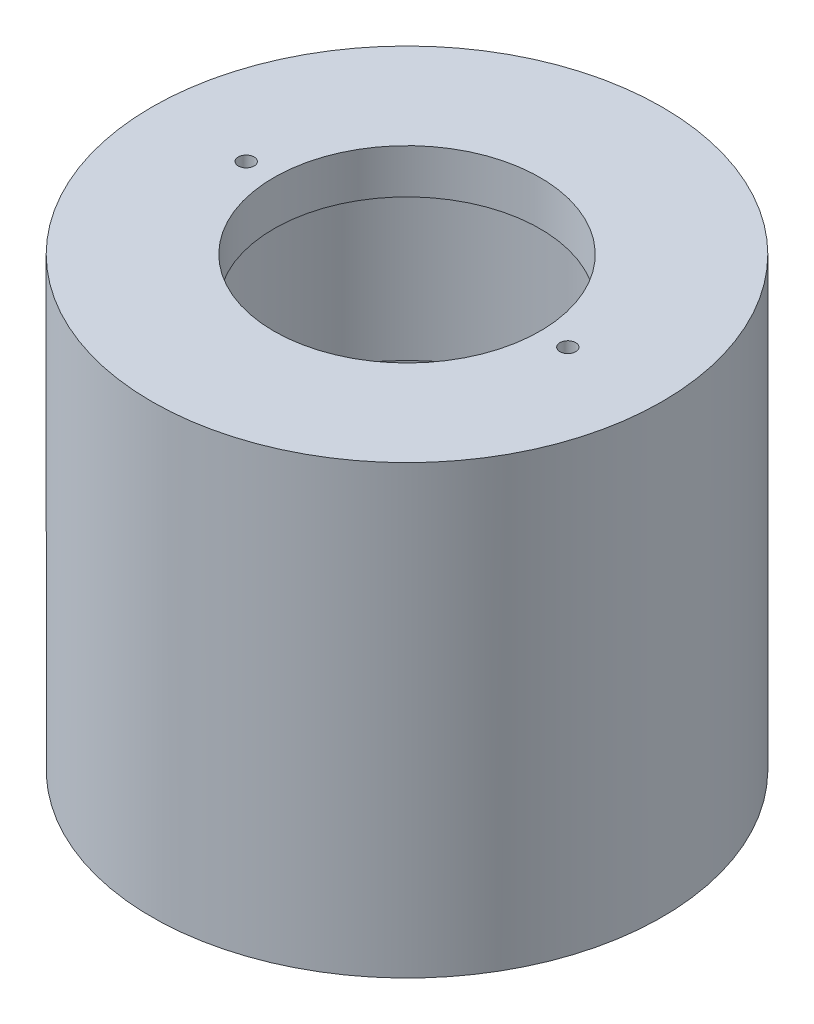
from build123d import *

# Parameters (mm, degrees)
SKETCH1_R           = 36.5125
SKETCH1_R_2         = 33.3375
BOSS_EXTRUDE1_DEPTH = 51.435
BOSS_EXTRUDE5_START = 6.096
SKETCH6_R           = 36.5125
SKETCH6_R_2         = 33.3375
BOSS_EXTRUDE5_DEPTH = 6.096
SKETCH12_R          = 33.3375
SKETCH12_R_2        = 25.4
BOSS_EXTRUDE8_DEPTH = 28.321
SKETCH2_R           = 36.5125
SKETCH2_R_2         = 19.05
BOSS_EXTRUDE2_DEPTH = 6.35
SKETCH4_R           = 26.9494
CUT_EXTRUDE1_DEPTH  = 1.7272
SKETCH5_R           = 1.1303
CUT_EXTRUDE5_DEPTH  = 83.140778384


with BuildPart() as part:
    # Sketch1 → Boss-Extrude1 (new body)
    with BuildSketch(Plane(origin=(0, 0, 0), x_dir=(1, 0, 0), z_dir=(0, 1, 0))):
        with Locations(Location((0, 0, 0), (0, 0, 270))):
            Circle(SKETCH1_R)
        with Locations(Location((0, 0, 0), (0, 0, 270))):
            Circle(SKETCH1_R_2, mode=Mode.SUBTRACT)
    extrude(amount=BOSS_EXTRUDE1_DEPTH)

    # Sketch6 → Boss-Extrude5 (add)
    with BuildSketch(Plane.XZ.offset(BOSS_EXTRUDE5_START)):
        with Locations(Location((0, 0, 0), (0, 0, 270))):
            Circle(SKETCH6_R)
        with Locations(Location((0, 0, 0), (0, 0, 270))):
            Circle(SKETCH6_R_2, mode=Mode.SUBTRACT)
    extrude(amount=-BOSS_EXTRUDE5_DEPTH)

    # Sketch12 → Boss-Extrude8 (add)
    with BuildSketch(Plane.XZ.offset(-23.114)):
        with Locations(Location((0, 0, 0), (0, 0, 270))):
            Circle(SKETCH12_R)
        with Locations(Location((0, 0, 0), (0, 0, 270))):
            Circle(SKETCH12_R_2, mode=Mode.SUBTRACT)
    extrude(amount=-BOSS_EXTRUDE8_DEPTH)

    # Sketch2 → Boss-Extrude2 (add)
    with BuildSketch(Plane(origin=(0, 51.435, 0), x_dir=(1, 0, 0), z_dir=(0, 1, 0))):
        with Locations(Location((0, 0, 0), (0, 0, 90))):
            Circle(SKETCH2_R)
        with Locations(Location((0, 0, 0), (0, 0, 270))):
            Circle(SKETCH2_R_2, mode=Mode.SUBTRACT)
    extrude(amount=BOSS_EXTRUDE2_DEPTH)

    # Sketch4 → Cut-Extrude1 (cut)
    with BuildSketch(Plane.XZ.offset(-26.67)):
        with Locations(Location((0, 0, 0), (0, 0, 270))):
            Circle(SKETCH4_R)
    extrude(amount=CUT_EXTRUDE1_DEPTH, mode=Mode.SUBTRACT)

    # Sketch5 → Cut-Extrude5 (cut, through all)
    with BuildSketch(Plane(origin=(0, 57.785, 0), x_dir=(1, 0, 0), z_dir=(0, 1, 0))):
        with Locations(Location((-23.0124, 0, 0), (0, 0, 270))):
            Circle(SKETCH5_R)
        with Locations(Location((23.0124, 0, 0), (0, 0, 270))):
            Circle(SKETCH5_R)
    extrude(amount=-CUT_EXTRUDE5_DEPTH, mode=Mode.SUBTRACT)


solid = part.part
